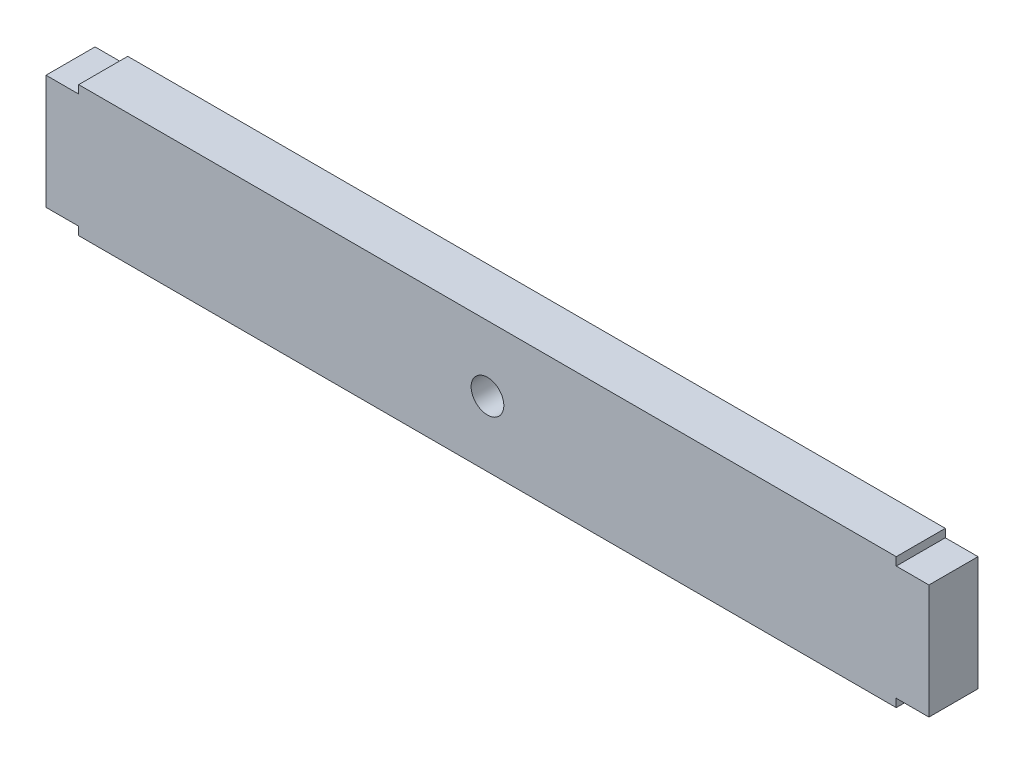
from build123d import *

# Parameters (mm, degrees)
SKETCH_1_R      = 10
EXTRUDE_1_DEPTH = 30


with BuildPart() as part:
    # 草图1 → 凸台-拉伸1 (new body)
    with BuildSketch(Plane.XY):
        Polygon((-250, -40), (250, -40), (250, -35), (270, -35), (270, 35), (250, 35), (250, 40), (-250, 40), (-250, 35), (-270, 35), (-270, -35), (-250, -35), align=None)
        Circle(SKETCH_1_R, mode=Mode.SUBTRACT)
    extrude(amount=EXTRUDE_1_DEPTH)


solid = part.part
